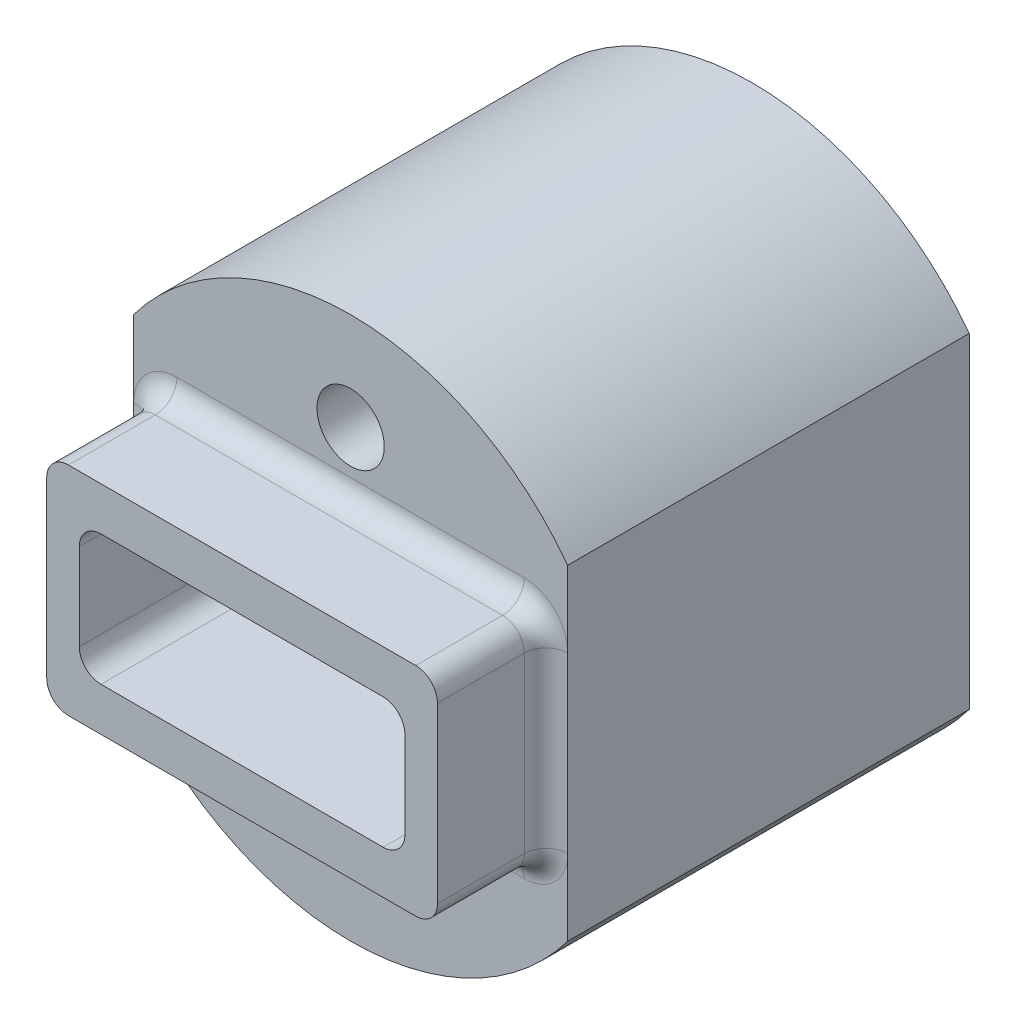
from build123d import *

# Parameters (mm, degrees)
AUFSATZ_LINEAR_AUSTRAGEN1_DEPTH      = 7.5
AUFSATZ_LINEAR_AUSTRAGEN1_DEPTH_BACK = 11
SKIZZE1_R                            = 12.5
SKIZZE1_R_2                          = 1.55
SCHNITT_LINEAR_AUSTRAGEN1_DEPTH      = 4.5
AUFSATZ_LINEAR_AUSTRAGEN2_DEPTH      = 5
SCHNITT_LINEAR_AUSTRAGEN4_DEPTH      = 22.650635095
SCHNITT_LINEAR_AUSTRAGEN4_DEPTH_BACK = 22.650635095
SCHNITT_LINEAR_AUSTRAGEN5_DEPTH      = 10
SCHNITT_LINEAR_AUSTRAGEN5_DEPTH_BACK = 22.650635095
SKIZZE5_OUTSIDE_W                    = 35.49
SKIZZE5_OUTSIDE_H                    = 35.49
SKIZZE5_OUTSIDE_W_2                  = 20
SKIZZE5_OUTSIDE_H_2                  = 30
VERRUNDUNG1_R                        = 1.2
VERRUNDUNG2_R                        = 1


with BuildPart() as part:
    # Skizze1 → Aufsatz-Linear austragen1 (new, two sides: drawn at the far end of the back side and taken through both)
    with BuildSketch(Plane.XY.offset(-AUFSATZ_LINEAR_AUSTRAGEN1_DEPTH_BACK)):
        Circle(SKIZZE1_R)
        with Locations((0, 8)):
            Circle(SKIZZE1_R_2, mode=Mode.SUBTRACT)
        with Locations(Location((0, -8, 0), (0, 0, 180))):
            Circle(SKIZZE1_R_2, mode=Mode.SUBTRACT)
    extrude(amount=AUFSATZ_LINEAR_AUSTRAGEN1_DEPTH + AUFSATZ_LINEAR_AUSTRAGEN1_DEPTH_BACK)

    # Skizze2 → Schnitt-Linear austragen1 (cut)
    with BuildSketch(Plane(origin=(0, 0, -11), x_dir=(-1, 0, 0), z_dir=(0, 0, -1))):
        with BuildLine():
            Line((-9, -4), (-9, 4))
            ThreePointArc((-9, 4), (-8.707106781, 4.707106781), (-8, 5))
            Line((-8, 5), (8, 5))
            ThreePointArc((8, 5), (8.707106781, 4.707106781), (9, 4))
            Line((9, 4), (9, -4))
            ThreePointArc((9, -4), (8.707106781, -4.707106781), (8, -5))
            Line((8, -5), (-8, -5))
            ThreePointArc((-8, -5), (-8.707106781, -4.707106781), (-9, -4))
        make_face()
    extrude(amount=-SCHNITT_LINEAR_AUSTRAGEN1_DEPTH, mode=Mode.SUBTRACT)

    # Skizze3 → Aufsatz-Linear austragen2 (add)
    with BuildSketch(Plane.XY.offset(7.5)):
        with BuildLine():
            Line((-8, 5), (8, 5))
            ThreePointArc((8, 5), (8.707106781, 4.707106781), (9, 4))
            Line((9, 4), (9, -4))
            ThreePointArc((9, -4), (8.707106781, -4.707106781), (8, -5))
            Line((8, -5), (-8, -5))
            ThreePointArc((-8, -5), (-8.707106781, -4.707106781), (-9, -4))
            Line((-9, -4), (-9, 4))
            ThreePointArc((-9, 4), (-8.707106781, 4.707106781), (-8, 5))
        make_face()
    extrude(amount=AUFSATZ_LINEAR_AUSTRAGEN2_DEPTH)

    # Skizze4 → Schnitt-Linear austragen4 (cut, two sides: drawn at the far end of the back side and taken through both)
    with BuildSketch(Plane.XY.offset(-SCHNITT_LINEAR_AUSTRAGEN4_DEPTH_BACK)):
        with BuildLine():
            Line((-6.5, -3), (6.5, -3))
            ThreePointArc((6.5, -3), (7.207106781, -2.707106781), (7.5, -2))
            Line((7.5, -2), (7.5, 2))
            ThreePointArc((7.5, 2), (7.207106781, 2.707106781), (6.5, 3))
            Line((6.5, 3), (-6.5, 3))
            ThreePointArc((-6.5, 3), (-7.207106781, 2.707106781), (-7.5, 2))
            Line((-7.5, 2), (-7.5, -2))
            ThreePointArc((-7.5, -2), (-7.207106781, -2.707106781), (-6.5, -3))
        make_face()
    extrude(amount=SCHNITT_LINEAR_AUSTRAGEN4_DEPTH + SCHNITT_LINEAR_AUSTRAGEN4_DEPTH_BACK, mode=Mode.SUBTRACT)

    # Skizze5 outside → Schnitt-Linear austragen5 (cut, two sides: drawn at the far end of the back side and taken through both)
    with BuildSketch(Plane.XY.offset(-SCHNITT_LINEAR_AUSTRAGEN5_DEPTH_BACK)):
        Rectangle(SKIZZE5_OUTSIDE_W, SKIZZE5_OUTSIDE_H)
        Rectangle(SKIZZE5_OUTSIDE_W_2, SKIZZE5_OUTSIDE_H_2, mode=Mode.SUBTRACT)
    extrude(amount=SCHNITT_LINEAR_AUSTRAGEN5_DEPTH + SCHNITT_LINEAR_AUSTRAGEN5_DEPTH_BACK, mode=Mode.SUBTRACT)

    # Verrundung1
    verrundung1_edges = [part.edges().sort_by_distance(p)[0] for p in [
        (-8.707106781, 4.707106781, -11),
        (-8.707106781, -4.707106781, -11),
        (0, -5, -11),
        (8.707106781, -4.707106781, -11),
        (8.707106781, 4.707106781, -11),
        (0, 5, -11),
    ]]
    fillet(verrundung1_edges, radius=VERRUNDUNG1_R)

    # Verrundung2
    verrundung2_edges = [part.edges().sort_by_distance(p)[0] for p in [
        (8.707106781, 4.707106781, 7.5),
        (0, 5, 7.5),
        (-8.707106781, 4.707106781, 7.5),
        (-9, 0, 7.5),
        (-8.707106781, -4.707106781, 7.5),
        (0, -5, 7.5),
        (8.707106781, -4.707106781, 7.5),
        (9, 0, 7.5),
    ]]
    fillet(verrundung2_edges, radius=VERRUNDUNG2_R - 0.0001)  # a hair under: the kernel refuses the full size


solid = part.part
